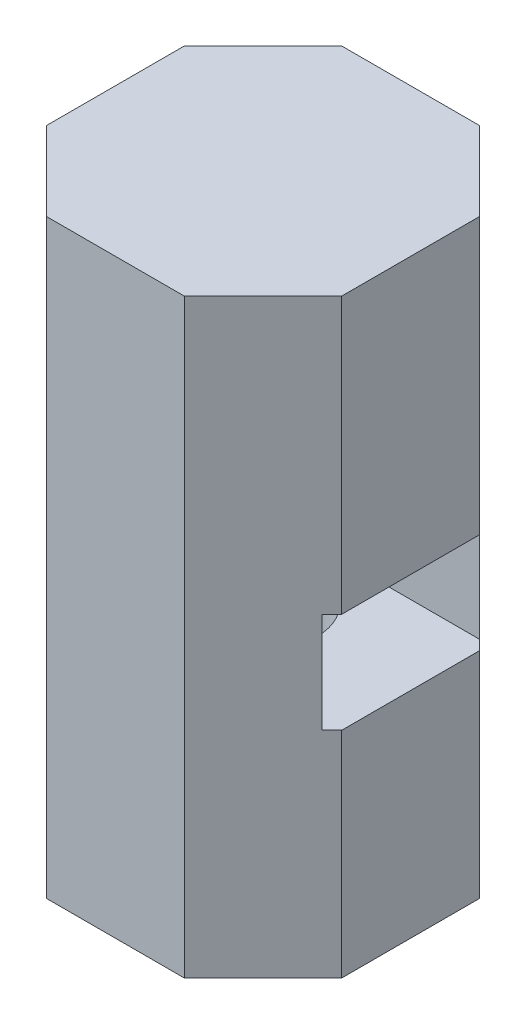
from build123d import *

# Parameters (mm, degrees)
SKETCH1_W           = 15
SKETCH1_H           = 30
BOSS_EXTRUDE1_DEPTH = 7.5
SKETCH2_R           = 5.25
CUT_EXTRUDE1_DEPTH  = 6
SKETCH4_R           = 2.75
CUT_EXTRUDE3_DEPTH  = 28
CUT_EXTRUDE4_REACH  = 36.369
SKETCH5_W           = 8
SKETCH5_H           = 5.1
CHAMFER3_SIZE       = 4


with BuildPart() as part:
    # Sketch1 → Boss-Extrude1 (new, symmetric)
    with BuildSketch(Plane.XY):
        with Locations((-3.5, -15)):
            Rectangle(SKETCH1_W, SKETCH1_H)
    extrude(amount=BOSS_EXTRUDE1_DEPTH, both=True)

    # Sketch2 → Cut-Extrude1 (cut)
    with BuildSketch(Plane.XZ.offset(30)):
        with Locations((-3.5, 0)):
            Circle(SKETCH2_R)
    extrude(amount=-CUT_EXTRUDE1_DEPTH, mode=Mode.SUBTRACT)

    # Sketch4 → Cut-Extrude3 (cut)
    with BuildSketch(Plane.XZ.offset(30)):
        with Locations((-3.5, 0)):
            Circle(SKETCH4_R)
    extrude(amount=-CUT_EXTRUDE3_DEPTH, mode=Mode.SUBTRACT)

    # Sketch5 → Cut-Extrude4 (cut, up to next)
    with BuildSketch(Plane(origin=(4, 0, 0), x_dir=(0, 0, -1), z_dir=(1, 0, 0)), mode=Mode.PRIVATE) as cut_extrude4_sk1:
        with Locations((0, -16.55)):
            Rectangle(SKETCH5_W, SKETCH5_H)
    cut_extrude4_tool1 = extrude(cut_extrude4_sk1.sketch, amount=-CUT_EXTRUDE4_REACH, mode=Mode.PRIVATE) & part.part
    add(cut_extrude4_tool1.solids().sort_by_distance((4, -16.55, 0))[0], mode=Mode.SUBTRACT)

    # Chamfer3
    # the kernel refuses this chamfer: 4 mm, written as the material it takes off along each edge
    with BuildSketch(Plane(origin=(-11, -40.286731952, 7.5), x_dir=(0.9996219169112968, 0, 0.027495876610586275), z_dir=(0, 1, 0)), Plane(origin=(4, 10.286731952, -7.5), x_dir=(0.02749587661058638, 0, 0.9996219169112968), z_dir=(0, -1, 0))) as chamfer3_piece_1:
        Polygon((CHAMFER3_SIZE * 0.999621916911, CHAMFER3_SIZE * 0.0274958766106), (-CHAMFER3_SIZE * 0.0274958766106, CHAMFER3_SIZE * 0.999621916911), (0, 0), align=None)
    extrude(amount=50.573463904, mode=Mode.SUBTRACT)
    with BuildSketch(Plane(origin=(-11, -40.286731952, -7.5), x_dir=(0.9996219169112968, 0, -0.027495876610586275), z_dir=(0, 1, 0)), Plane(origin=(4, 10.286731952, 7.5), x_dir=(0.02749587661058638, 0, -0.9996219169112968), z_dir=(0, -1, 0))) as chamfer3_piece_2:
        Polygon((CHAMFER3_SIZE * 0.999621916911, -CHAMFER3_SIZE * 0.0274958766106), (-CHAMFER3_SIZE * 0.0274958766106, -CHAMFER3_SIZE * 0.999621916911), (0, 0), align=None)
    extrude(amount=50.573463904, mode=Mode.SUBTRACT)


solid = part.part
